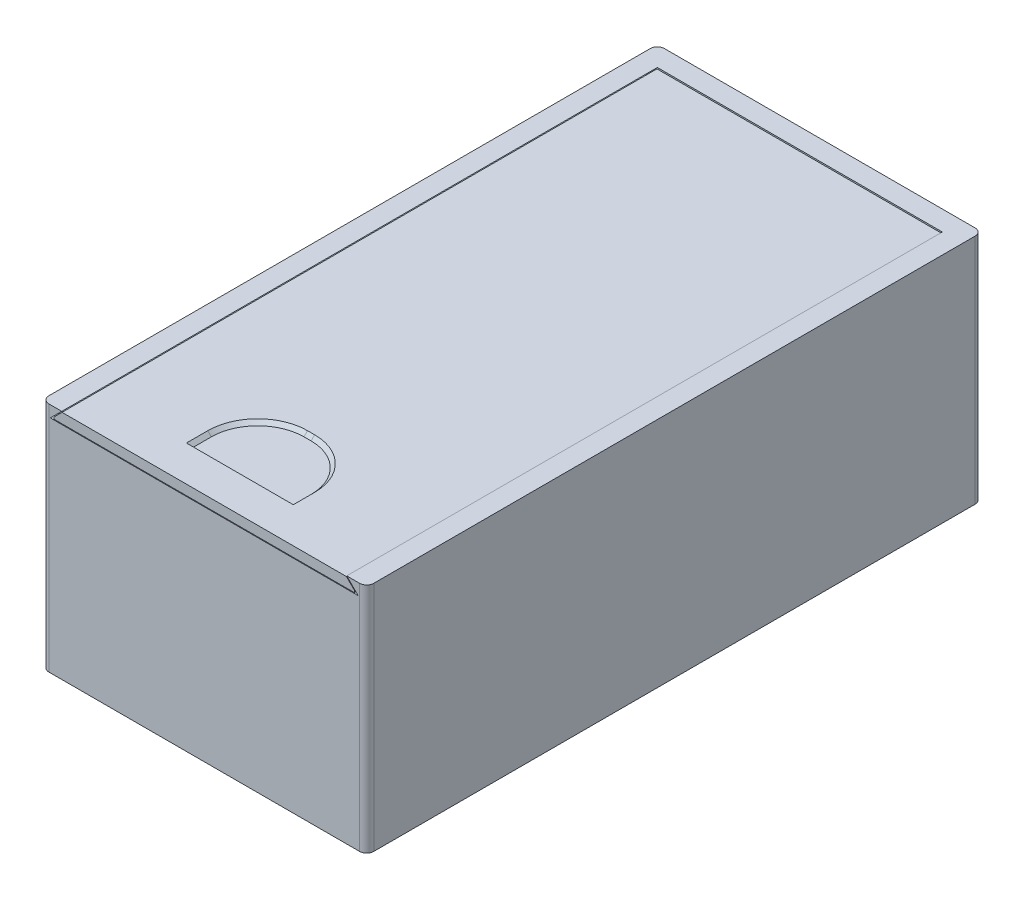
from build123d import *

# Parameters (mm, degrees)
SKETCH1_W           = 45.6
SKETCH1_H           = 32.6
BOSS_EXTRUDE1_DEPTH = 86.4
SHELL1_T            = -2.8
CUT_EXTRUDE1_DEPTH  = 83.6
BOSS_EXTRUDE2_DEPTH = 83.5
SKETCH5_W           = 15
SKETCH5_H           = 10
CUT_EXTRUDE3_DEPTH  = 0.5
FILLET1_R           = 7
CHAMFER1_SIZE       = 0.5
FILLET2_R           = 1
CUT_EXTRUDE4_DEPTH  = 83.5


with BuildPart() as part:
    # Sketch1 → Boss-Extrude1 (new body)
    with BuildSketch(Plane.XY):
        Rectangle(SKETCH1_W, SKETCH1_H)
    extrude(amount=BOSS_EXTRUDE1_DEPTH)

    # Shell1
    shell1_openings = [part.faces().sort_by_distance(p)[0] for p in [
        (0, 16.3, 43.2),
    ]]
    offset(amount=SHELL1_T, openings=shell1_openings, kind=Kind.INTERSECTION)

    # Sketch2 → Cut-Extrude1 (cut)
    with BuildSketch(Plane.XY.offset(86.4)):
        Polygon((20, 16.3), (-20, 16.3), (-21.6, 14.7), (21.6, 14.7), align=None)
    extrude(amount=-CUT_EXTRUDE1_DEPTH, mode=Mode.SUBTRACT)

    # Fillet2
    fillet2_edges = [part.edges().sort_by_distance(p)[0] for p in [
        (-22.8, 0, 86.4),
        (22.8, 0, 86.4),
        (-22.8, 0, 0),
        (22.8, 0, 0),
    ]]
    fillet(fillet2_edges, radius=FILLET2_R)


with BuildPart() as body_2:
    # Sketch3 → Boss-Extrude2 (new body)
    with BuildSketch(Plane.XY.offset(86.4)):
        Polygon((19.958578644, 16.2), (-19.958578644, 16.2), (-21.358578644, 14.8), (21.358578644, 14.8), align=None)
    extrude(amount=-BOSS_EXTRUDE2_DEPTH)

    # Sketch5 → Cut-Extrude3 (cut)
    with BuildSketch(Plane(origin=(0, 16.2, 0), x_dir=(1, 0, 0), z_dir=(0, 1, 0))):
        with Locations((0, -76.4)):
            Rectangle(SKETCH5_W, SKETCH5_H)
    extrude(amount=-CUT_EXTRUDE3_DEPTH, mode=Mode.SUBTRACT)

    # Fillet1
    fillet1_edges = [body_2.edges().sort_by_distance(p)[0] for p in [
        (7.5, 15.95, 71.4),
        (-7.5, 15.95, 71.4),
    ]]
    fillet(fillet1_edges, radius=FILLET1_R)

    # Chamfer1
    chamfer1_edges = [body_2.edges().sort_by_distance(p)[0] for p in [
        (7.5, 15.7, 79.9),
        (5.449747468, 15.7, 73.450252532),
        (0, 15.7, 71.4),
        (-7.5, 15.7, 79.9),
        (-5.449747468, 15.7, 73.450252532),
    ]]
    chamfer(chamfer1_edges, length=CHAMFER1_SIZE - 0.0001)  # a hair under: the kernel refuses the full size

    # Sketch6 → Cut-Extrude4 (cut)
    with BuildSketch(Plane.XY.offset(86.4)):
        Polygon((-21.058578644, 15.1), (-21.358578644, 14.8), (-21.058578644, 14.8), align=None)
        Polygon((21.058578644, 15.1), (21.058578644, 14.8), (21.358578644, 14.8), align=None)
    extrude(amount=-CUT_EXTRUDE4_DEPTH, mode=Mode.SUBTRACT)


solid = Compound([part.part, body_2.part])
